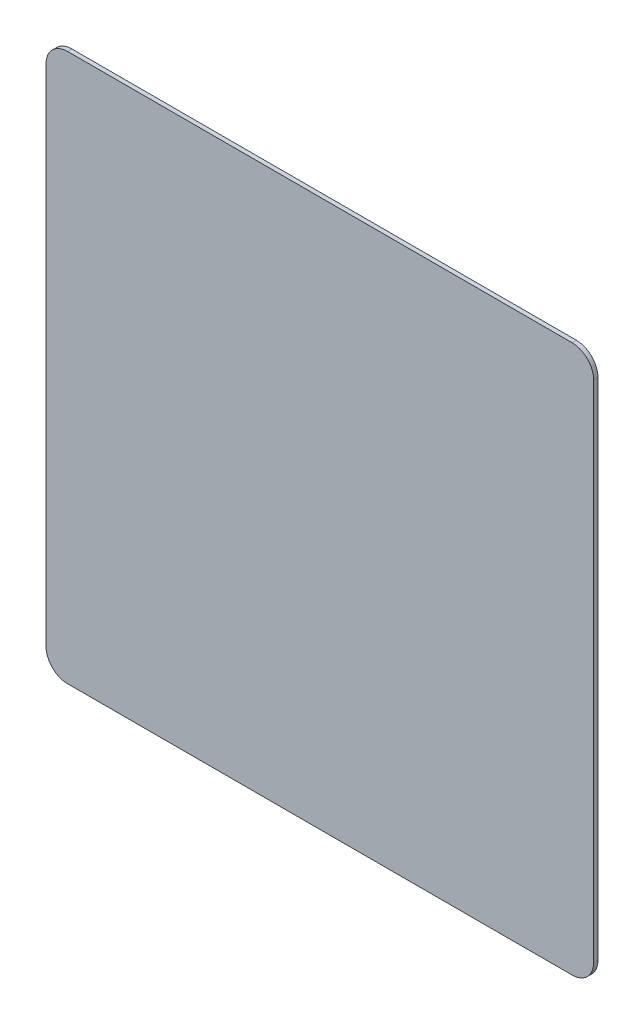
from build123d import *

# Parameters (mm, degrees)
SKETCH1_W           = 510
SKETCH1_H           = 510
BOSS_EXTRUDE1_DEPTH = 4
FILLET1_R           = 20


with BuildPart() as part:
    # Sketch1 → Boss-Extrude1 (new body)
    with BuildSketch(Plane.XY):
        Rectangle(SKETCH1_W, SKETCH1_H)
    extrude(amount=BOSS_EXTRUDE1_DEPTH)

    # Fillet1
    fillet1_edges = [part.edges().sort_by_distance(p)[0] for p in [
        (255, -255, 2),
        (-255, -255, 2),
        (-255, 255, 2),
        (255, 255, 2),
    ]]
    fillet(fillet1_edges, radius=FILLET1_R)


solid = part.part
